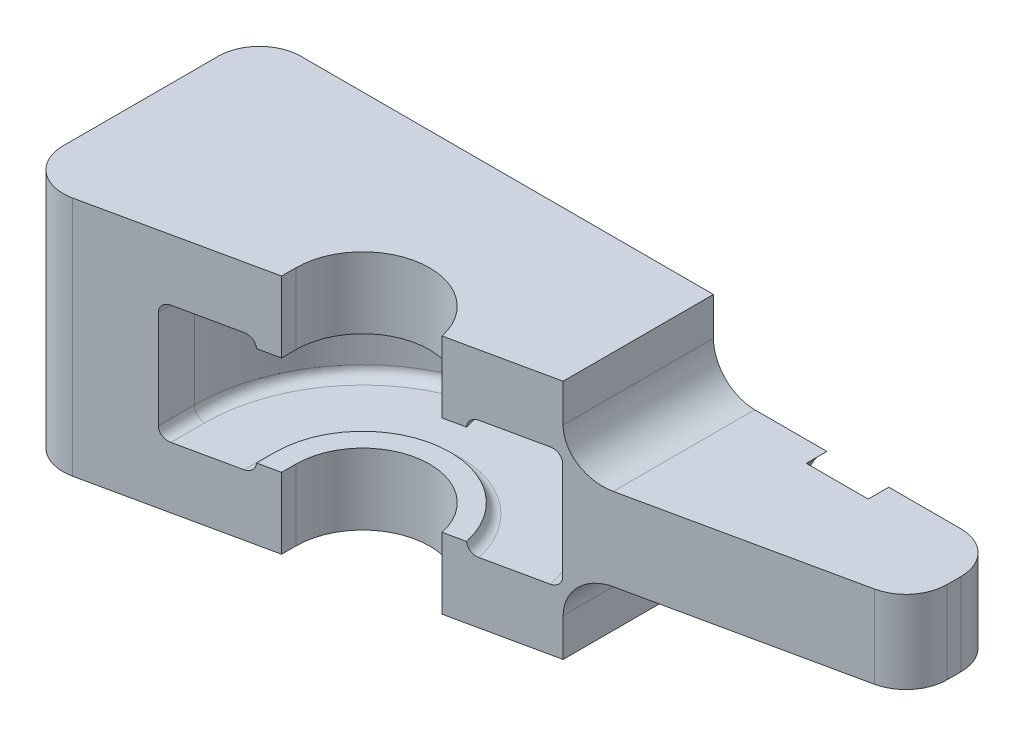
from build123d import *

# Parameters (mm, degrees)
SKETCH1_W               = 57.15
SKETCH1_H               = 18.542
BOSS_EXTRUDE1_DEPTH     = 19.05
CUT_EXTRUDE1_DEPTH      = 41.848617676
CUT_EXTRUDE1_DEPTH_BACK = 41.848617676
CUT_EXTRUDE2_DEPTH      = 4.572
CUT_EXTRUDE2_DEPTH_BACK = 4.572
CUT_EXTRUDE3_DEPTH      = 3.81
CUT_EXTRUDE3_DEPTH_BACK = 3.81
CUT_EXTRUDE5_DEPTH      = 44.89150133
FILLET1_R               = 3.175
SKETCH9_R               = 3.96875
CUT_EXTRUDE6_DEPTH      = 1.5875
SKETCH10_W              = 22.225
SKETCH10_H              = 6.096
CUT_EXTRUDE7_DEPTH      = 41.503184716
FILLET2_R               = 3.175
FILLET3_R               = 0.79375


with BuildPart() as part:
    # Sketch1 → Boss-Extrude1 (new body)
    with BuildSketch(Plane.XY):
        with Locations((6.35, 0)):
            Rectangle(SKETCH1_W, SKETCH1_H)
    extrude(amount=BOSS_EXTRUDE1_DEPTH)

    # Sketch3 → Cut-Extrude1 (cut, two sides: drawn at the far end of the back side and taken through both)
    with BuildSketch(Plane(origin=(0, 0, 0), x_dir=(1, 0, 0), z_dir=(0, 1, 0)).offset(-CUT_EXTRUDE1_DEPTH_BACK)):
        with BuildLine():
            Line((-5.1435, -19.05), (-5.1435, -14.2875))
            ThreePointArc((-5.1435, -14.2875), (0, -9.144), (5.1435, -14.2875))
            Line((5.1435, -14.2875), (5.1435, -19.05))
            ThreePointArc((5.1435, -19.05), (0, -24.1935), (-5.1435, -19.05))
        make_face()
    extrude(amount=CUT_EXTRUDE1_DEPTH + CUT_EXTRUDE1_DEPTH_BACK, mode=Mode.SUBTRACT)

    # Sketch5 → Cut-Extrude2 (cut, two sides: drawn at the far end of the back side and taken through both)
    with BuildSketch(Plane(origin=(0, 0, 0), x_dir=(1, 0, 0), z_dir=(0, 1, 0)).offset(-CUT_EXTRUDE2_DEPTH_BACK)):
        with BuildLine():
            Line((12.954, -14.2875), (12.954, -19.05))
            ThreePointArc((12.954, -19.05), (0, -32.004), (-12.954, -19.05))
            Line((-12.954, -19.05), (-12.954, -14.2875))
            ThreePointArc((-12.954, -14.2875), (0, -1.3335), (12.954, -14.2875))
        make_face()
        with BuildLine():
            Line((-6.731, -19.05), (-6.731, -14.2875))
            ThreePointArc((-6.731, -14.2875), (0, -7.5565), (6.731, -14.2875))
            Line((6.731, -14.2875), (6.731, -19.05))
            ThreePointArc((6.731, -19.05), (0, -25.781), (-6.731, -19.05))
        make_face(mode=Mode.SUBTRACT)
    extrude(amount=CUT_EXTRUDE2_DEPTH + CUT_EXTRUDE2_DEPTH_BACK, mode=Mode.SUBTRACT)

    # Sketch6 → Cut-Extrude3 (cut, two sides: drawn at the far end of the back side and taken through both)
    with BuildSketch(Plane(origin=(0, 0, 0), x_dir=(1, 0, 0), z_dir=(0, 1, 0)).offset(-CUT_EXTRUDE3_DEPTH_BACK)):
        with BuildLine():
            Line((-8.3185, -19.05), (-8.3185, -14.2875))
            ThreePointArc((-8.3185, -14.2875), (0, -5.969), (8.3185, -14.2875))
            Line((8.3185, -14.2875), (8.3185, -19.05))
            ThreePointArc((8.3185, -19.05), (0, -27.3685), (-8.3185, -19.05))
        make_face()
    extrude(amount=CUT_EXTRUDE3_DEPTH + CUT_EXTRUDE3_DEPTH_BACK, mode=Mode.SUBTRACT)

    # Sketch8 → Cut-Extrude5 (cut, through all)
    with BuildSketch(Plane.XZ.offset(9.271)):
        Polygon((-22.225, 19.05), (34.925, 19.05), (34.925, 6.803571429), align=None)
    extrude(amount=-CUT_EXTRUDE5_DEPTH, mode=Mode.SUBTRACT)

    # Fillet1
    fillet1_edges = [part.edges().sort_by_distance(p)[0] for p in [
        (-22.225, 0, 19.05),
        (34.925, 0, 6.803571429),
        (-22.225, 0, 0),
        (34.925, 0, 0),
    ]]
    fillet(fillet1_edges, radius=FILLET1_R)

    # Sketch9 → Cut-Extrude6 (cut)
    with BuildSketch(Plane(origin=(0, 0, 0), x_dir=(-1, 0, 0), z_dir=(0, 0, -1))):
        with Locations((-23.8125, 0)):
            Circle(SKETCH9_R)
    extrude(amount=-CUT_EXTRUDE6_DEPTH, mode=Mode.SUBTRACT)

    # Sketch10 → Cut-Extrude7 (cut, through all)
    with BuildSketch(Plane(origin=(0, 0, 0), x_dir=(-1, 0, 0), z_dir=(0, 0, -1))):
        with Locations((-23.8125, 6.223)):
            Rectangle(SKETCH10_W, SKETCH10_H)
        with Locations((-23.8125, -6.223)):
            Rectangle(SKETCH10_W, SKETCH10_H)
    extrude(amount=-CUT_EXTRUDE7_DEPTH, mode=Mode.SUBTRACT)

    # Fillet2
    fillet2_edges = [part.edges().sort_by_distance(p)[0] for p in [
        (12.7, 3.175, 5.783035714),
        (12.7, -3.175, 5.783035714),
    ]]
    fillet(fillet2_edges, radius=FILLET2_R)

    # Fillet3
    # the kernel refuses this fillet: 0.79375 mm, written as the material it adds along each edge
    with BuildSketch(Plane(origin=(-6.731, 4.572, 17.714232143), x_dir=(-1, 0, 0), z_dir=(0, 0, -1))) as fillet3_piece_1_section:
        with BuildLine():
            CenterArc((FILLET3_R, -FILLET3_R), FILLET3_R, 90, 90)
            Line((0, -FILLET3_R), (0, 0))
            Line((0, 0), (FILLET3_R, 0))
        make_face()
    fillet3_piece_1 = extrude(amount=3.426732143, mode=Mode.PRIVATE)
    fillet3_piece_1 = split(fillet3_piece_1, bisect_by=Plane(origin=(-6.763728877, 4.396665284, 15.736870474), z_dir=(-0.2095290887308735, 0, -0.9778024140774095)), keep=Keep.TOP, mode=Mode.PRIVATE)
    fillet3_piece_1 = split(fillet3_piece_1, bisect_by=Plane(origin=(-6.915533266, 3.81, 15.028449993), z_dir=(0, 1, 0)), keep=Keep.TOP, mode=Mode.PRIVATE)
    add(fillet3_piece_1)
    with BuildSketch(Plane(origin=(-6.731, -4.572, 17.714232143), x_dir=(-1, 0, 0), z_dir=(0, 0, -1))) as fillet3_piece_2_section:
        with BuildLine():
            CenterArc((FILLET3_R, FILLET3_R), FILLET3_R, 180, 90)
            Line((0, FILLET3_R), (0, 0))
            Line((0, 0), (FILLET3_R, 0))
        make_face()
    fillet3_piece_2 = extrude(amount=3.426732143, mode=Mode.PRIVATE)
    fillet3_piece_2 = split(fillet3_piece_2, bisect_by=Plane(origin=(-6.763728877, -4.396665284, 15.736870474), z_dir=(-0.2095290887308735, 0, -0.9778024140774095)), keep=Keep.TOP, mode=Mode.PRIVATE)
    fillet3_piece_2 = split(fillet3_piece_2, bisect_by=Plane(origin=(-6.915533266, -3.81, 15.028449993), z_dir=(0, -1, 0)), keep=Keep.TOP, mode=Mode.PRIVATE)
    add(fillet3_piece_2)
    with BuildSketch(Plane(origin=(-12.954, -4.572, 19.047732143), x_dir=(1, 0, 0), z_dir=(0, 0, -1))) as fillet3_piece_3_section:
        with BuildLine():
            CenterArc((FILLET3_R, -FILLET3_R), FILLET3_R, 90, 90)
            Line((0, -FILLET3_R), (0, 0))
            Line((0, 0), (FILLET3_R, 0))
        make_face()
    fillet3_piece_3 = extrude(amount=4.760232143, mode=Mode.PRIVATE)
    fillet3_piece_3 = split(fillet3_piece_3, bisect_by=Plane(origin=(-12.496129388, -4.39094469, 16.965242012), z_dir=(-0.2095290887308735, 0, -0.9778024140774095)), keep=Keep.TOP, mode=Mode.PRIVATE)
    add(fillet3_piece_3)
    with BuildSketch(Plane(origin=(-12.954, 4.572, 19.047732143), x_dir=(1, 0, 0), z_dir=(0, 0, -1))) as fillet3_piece_4_section:
        with BuildLine():
            CenterArc((FILLET3_R, FILLET3_R), FILLET3_R, 180, 90)
            Line((0, FILLET3_R), (0, 0))
            Line((0, 0), (FILLET3_R, 0))
        make_face()
    fillet3_piece_4 = extrude(amount=4.760232143, mode=Mode.PRIVATE)
    fillet3_piece_4 = split(fillet3_piece_4, bisect_by=Plane(origin=(-12.496129388, 4.39094469, 16.965242012), z_dir=(-0.2095290887308735, 0, -0.9778024140774095)), keep=Keep.TOP, mode=Mode.PRIVATE)
    add(fillet3_piece_4)
    with BuildSketch(Plane(origin=(0, 4.572, 14.2875), x_dir=(-1, 0, 0), z_dir=(0, 0, 1))) as fillet3_piece_5_section:
        with BuildLine():
            CenterArc((6.731 + FILLET3_R, FILLET3_R), FILLET3_R, 180, 90)
            Line((6.731 + FILLET3_R, 0), (6.731, 0))
            Line((6.731, 0), (6.731, FILLET3_R))
        make_face()
    fillet3_piece_5 = revolve(axis=Axis((0, 4.572, 14.2875), (0, -1, 0)), revolution_arc=167.905242923, mode=Mode.PRIVATE)
    fillet3_piece_5 = split(fillet3_piece_5, bisect_by=Plane(origin=(-0.733722895, 3.81, 7.361688783), z_dir=(0, 1, 0)), keep=Keep.TOP, mode=Mode.PRIVATE)
    add(fillet3_piece_5)
    with BuildSketch(Plane(origin=(0, -4.572, 14.2875), x_dir=(-1, 0, 0), z_dir=(0, 0, 1))) as fillet3_piece_6_section:
        with BuildLine():
            CenterArc((6.731 + FILLET3_R, -FILLET3_R), FILLET3_R, 90, 90)
            Line((6.731, -FILLET3_R), (6.731, 0))
            Line((6.731, 0), (6.731 + FILLET3_R, 0))
        make_face()
    fillet3_piece_6 = revolve(axis=Axis((0, -4.572, 14.2875), (0, -1, 0)), revolution_arc=167.905242923, mode=Mode.PRIVATE)
    fillet3_piece_6 = split(fillet3_piece_6, bisect_by=Plane(origin=(-0.733722895, -3.81, 7.361688783), z_dir=(0, -1, 0)), keep=Keep.TOP, mode=Mode.PRIVATE)
    add(fillet3_piece_6)
    with BuildSketch(Plane(origin=(0, -4.572, 14.2875), x_dir=(-1, 0, 0), z_dir=(0, 0, 1))) as fillet3_piece_7:
        with BuildLine():
            CenterArc((12.954 - FILLET3_R, -FILLET3_R), FILLET3_R, 0, 90)
            Line((12.954 - FILLET3_R, 0), (12.954, 0))
            Line((12.954, 0), (12.954, -FILLET3_R))
        make_face()
    revolve(axis=Axis((0, -4.572, 14.2875), (0, -1, 0)), revolution_arc=167.905242923)
    with BuildSketch(Plane(origin=(0, 4.572, 14.2875), x_dir=(-1, 0, 0), z_dir=(0, 0, 1))) as fillet3_piece_8:
        with BuildLine():
            CenterArc((12.954 - FILLET3_R, FILLET3_R), FILLET3_R, 270, 90)
            Line((12.954, FILLET3_R), (12.954, 0))
            Line((12.954, 0), (12.954 - FILLET3_R, 0))
        make_face()
    revolve(axis=Axis((0, 4.572, 14.2875), (0, -1, 0)), revolution_arc=167.905242923)


solid = part.part
